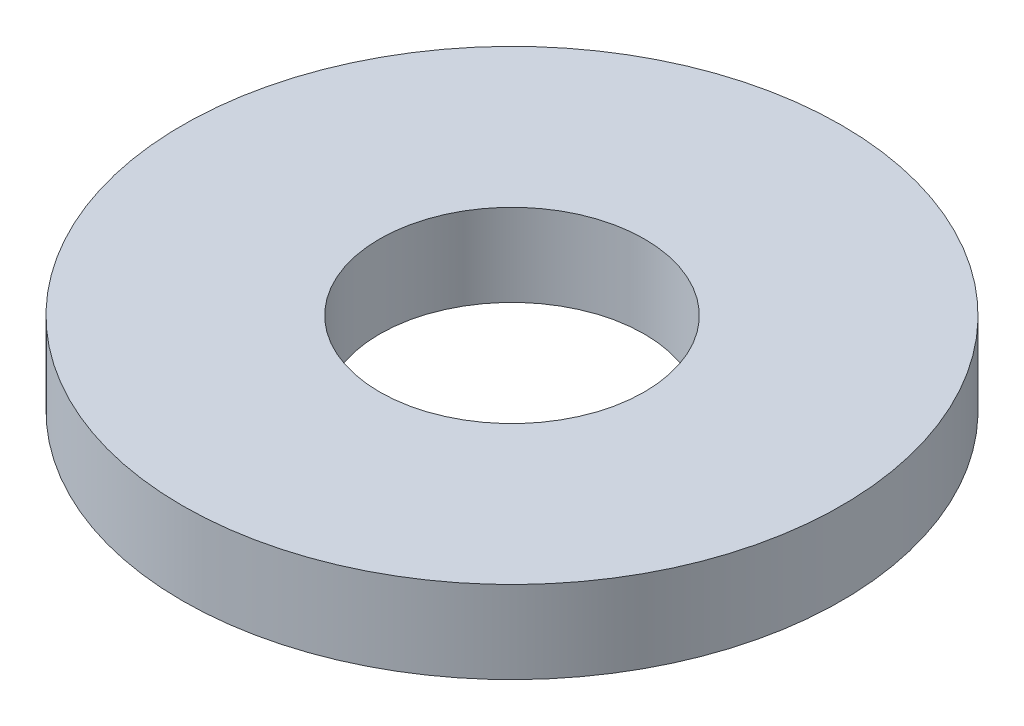
from build123d import *

# Parameters (mm, degrees)
SKETCH1_R           = 6.35
SKETCH1_R_2         = 2.5527
BOSS_EXTRUDE1_DEPTH = 1.5875


with BuildPart() as part:
    # Sketch1 → Boss-Extrude1 (new body)
    with BuildSketch(Plane(origin=(0, 0, 0), x_dir=(1, 0, 0), z_dir=(0, 1, 0))):
        Circle(SKETCH1_R)
        Circle(SKETCH1_R_2, mode=Mode.SUBTRACT)
    extrude(amount=BOSS_EXTRUDE1_DEPTH)


solid = part.part
